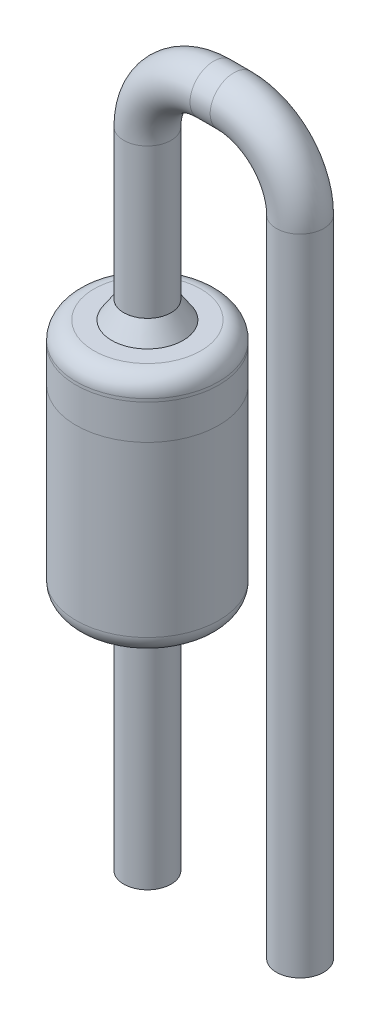
from build123d import *

# Parameters (mm, degrees)
SKETCH6_R = 0.39375


with BuildPart() as part:
    # Sketch10 → BODY_main (revolve)
    with BuildSketch(Plane.XY):
        with BuildLine():
            Line((-0.890625, 5.335), (-0.59375, 5.335))
            Line((-0.59375, 5.335), (-0.59375, 1.3))
            Line((-0.59375, 1.3), (-0.890625, 1.3))
            ThreePointArc((-0.890625, 1.3), (-1.100547326, 1.386952674), (-1.1875, 1.596875))
            Line((-1.1875, 1.596875), (-1.1875, 5.038125))
            ThreePointArc((-1.1875, 5.038125), (-1.100547326, 5.248047326), (-0.890625, 5.335))
        make_face()
    revolve(axis=Axis((0, 1, 0), (0, 1, 0)))


with BuildPart() as body_2:
    # Sketch11 → BODY_to_PIN (revolve)
    with BuildSketch(Plane.XY):
        Polygon((0, 1.3), (0, 1), (-0.39375, 1), (-0.59375, 1.3), align=None)
        Polygon((-0.59375, 5.335), (0, 5.335), (0, 5.635), (-0.39375, 5.635), align=None)
    revolve(axis=Axis((0, 1, 0), (0, 1, 0)))


with BuildPart() as body_3:
    # PINS: sweep along a path in Sketch7
    with BuildLine(Plane.XY) as pins_path:
        Line((0, -2.6), (0, 8.11819705))
        ThreePointArc((0, 8.11819705), (0.322914774, 8.897782276), (1.1025, 9.22069705))
        Line((1.1025, 9.22069705), (1.4375, 9.22069705))
        ThreePointArc((1.4375, 9.22069705), (2.217085226, 8.897782276), (2.54, 8.11819705))
        Line((2.54, 8.11819705), (2.54, -2.6))
    # Sketch6 → PINS (sweep)
    with BuildSketch(Plane(origin=(1, 1, 0), x_dir=(0, 0, -1), z_dir=(0, 1, 0))):
        with Locations((0, 1)):
            Circle(SKETCH6_R)
    sweep(path=pins_path.line)


solid = Compound([part.part, body_2.part, body_3.part])
